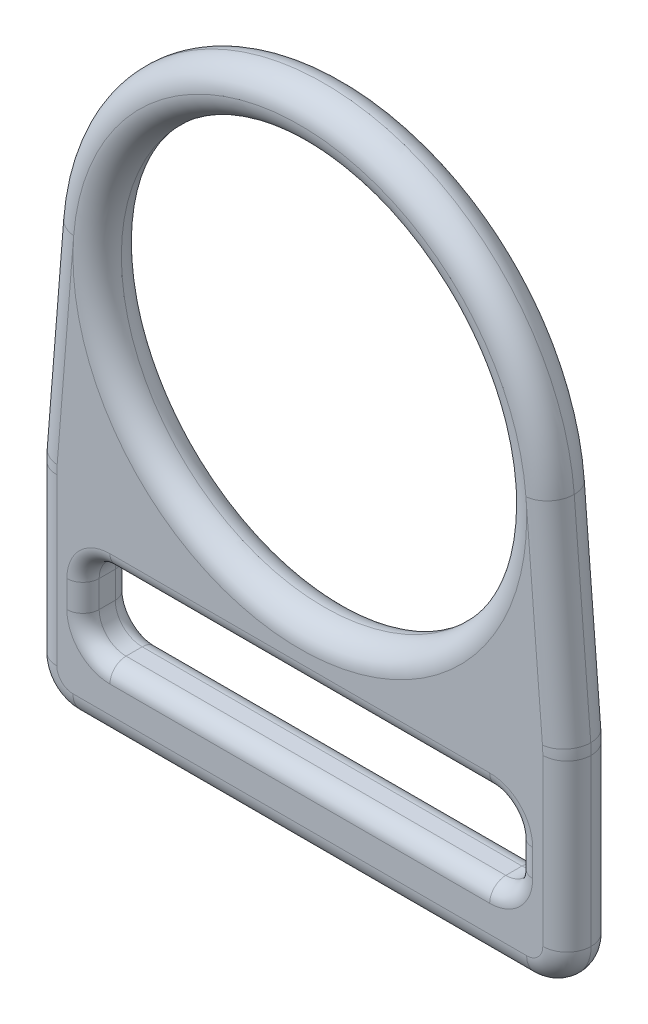
from build123d import *

# Parameters (mm, degrees)
SKETCH2_R                = 2.286
BOSS_EXTRUDE1_DEPTH      = 2.286
BOSS_EXTRUDE1_DEPTH_BACK = 2.286
SKETCH4_R                = 19.14525
FILLET1_R                = 2.286
FILLET2_R                = 1.524


with BuildPart() as part:
    # Sweep1: sweep along a path in Sketch3
    with BuildLine(Plane.XY) as sweep1_path:
        CenterArc((0, -21.43125), 21.43125, 0, 360)
    # Sketch2 → Sweep1 (sweep)
    with BuildSketch(Plane(origin=(0, 0, 0), x_dir=(0, 0, -1), z_dir=(1, 0, 0))):
        Circle(SKETCH2_R)
    sweep(path=sweep1_path.line)

    # Sketch4 → Boss-Extrude1 (add, two sides: drawn at the far end of the back side and taken through both)
    with BuildSketch(Plane.XY.offset(-BOSS_EXTRUDE1_DEPTH_BACK)):
        with BuildLine():
            Line((-23.642078763, -19.544438056), (-25.200997664, -39.077960491))
            ThreePointArc((-25.200997664, -39.077960491), (-25.231182926, -39.582730267), (-25.24125, -40.088301559))
            Line((-25.24125, -40.088301559), (-25.24125, -55.72125))
            ThreePointArc((-25.24125, -55.72125), (-24.125326836, -58.415326836), (-21.43125, -59.53125))
            Line((-21.43125, -59.53125), (21.43125, -59.53125))
            ThreePointArc((21.43125, -59.53125), (24.125326836, -58.415326836), (25.24125, -55.72125))
            Line((25.24125, -55.72125), (25.24125, -40.088301559))
            ThreePointArc((25.24125, -40.088301559), (25.231182926, -39.582730267), (25.200997664, -39.077960491))
            Line((25.200997664, -39.077960491), (23.642078763, -19.544438056))
            ThreePointArc((23.642078763, -19.544438056), (0, 2.286), (-23.642078763, -19.544438056))
        make_face()
        with Locations((0, -21.43125)):
            Circle(SKETCH4_R, mode=Mode.SUBTRACT)
        with BuildLine():
            Line((-20.47875, -48.10125), (-20.47875, -50.64125))
            ThreePointArc((-20.47875, -50.64125), (-19.734801224, -52.437301224), (-17.93875, -53.18125))
            Line((-17.93875, -53.18125), (17.93875, -53.18125))
            ThreePointArc((17.93875, -53.18125), (19.734801224, -52.437301224), (20.47875, -50.64125))
            Line((20.47875, -50.64125), (20.47875, -48.10125))
            ThreePointArc((20.47875, -48.10125), (19.734801224, -46.305198776), (17.93875, -45.56125))
            Line((17.93875, -45.56125), (-17.93875, -45.56125))
            ThreePointArc((-17.93875, -45.56125), (-19.734801224, -46.305198776), (-20.47875, -48.10125))
        make_face(mode=Mode.SUBTRACT)
    extrude(amount=BOSS_EXTRUDE1_DEPTH + BOSS_EXTRUDE1_DEPTH_BACK)

    # Fillet1
    fillet1_edges = [part.edges().sort_by_distance(p)[0] for p in [
        (24.421538214, -29.311199273, 2.286),
        (25.231182926, -39.582730267, 2.286),
        (25.24125, -47.904775779, 2.286),
        (24.125326836, -58.415326836, 2.286),
        (0, -59.53125, 2.286),
        (-24.125326836, -58.415326836, 2.286),
        (-25.24125, -47.904775779, 2.286),
        (-25.231182926, -39.582730267, 2.286),
        (-24.421538214, -29.311199273, 2.286),
        (24.421538214, -29.311199273, -2.286),
        (25.231182926, -39.582730267, -2.286),
        (25.24125, -47.904775779, -2.286),
        (24.125326836, -58.415326836, -2.286),
        (0, -59.53125, -2.286),
        (-24.125326836, -58.415326836, -2.286),
        (-25.24125, -47.904775779, -2.286),
        (-25.231182926, -39.582730267, -2.286),
        (-24.421538214, -29.311199273, -2.286),
        (-19.14525, -21.43125, 2.286),
        (-19.14525, -21.43125, -2.286),
        (0, 2.286, 2.286),
        (0, 2.286, -2.286),
    ]]
    fillet(fillet1_edges, radius=FILLET1_R - 0.0001)  # a hair under: the kernel refuses the full size

    # Fillet2
    fillet2_edges = [part.edges().sort_by_distance(p)[0] for p in [
        (19.734801224, -46.305198776, 2.286),
        (0, -45.56125, 2.286),
        (-19.734801224, -46.305198776, 2.286),
        (-20.47875, -49.37125, 2.286),
        (-19.734801224, -52.437301224, 2.286),
        (0, -53.18125, 2.286),
        (19.734801224, -52.437301224, 2.286),
        (20.47875, -49.37125, 2.286),
        (20.47875, -49.37125, -2.286),
        (19.734801224, -46.305198776, -2.286),
        (0, -45.56125, -2.286),
        (-19.734801224, -46.305198776, -2.286),
        (-20.47875, -49.37125, -2.286),
        (-19.734801224, -52.437301224, -2.286),
        (0, -53.18125, -2.286),
        (19.734801224, -52.437301224, -2.286),
    ]]
    fillet(fillet2_edges, radius=FILLET2_R)


solid = part.part
